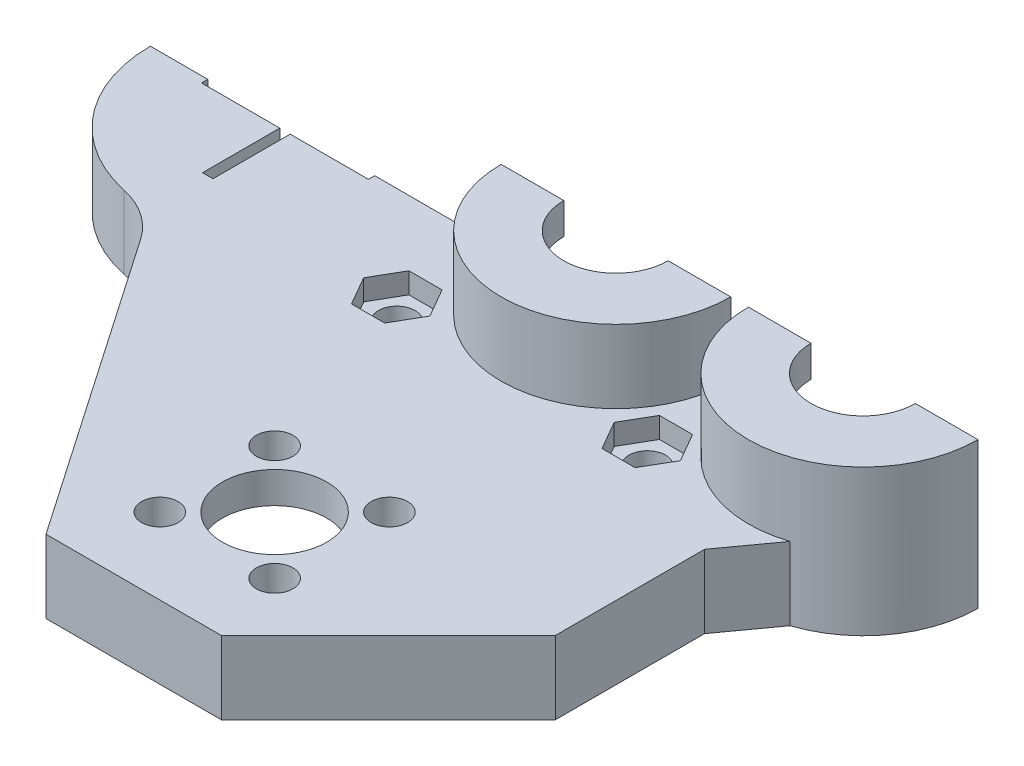
from build123d import *

# Parameters (mm, degrees)
SKETCH3_R               = 8
SKETCH3_R_2             = 5.000000000000001
BOSS_EXTRUDE1_DEPTH     = 7
CUT_EXTRUDE3_DEPTH      = 65.10592616131524
CUT_EXTRUDE3_DEPTH_BACK = 65.10592616131524
SKETCH4_R               = 1.7500000000000004
SKETCH4_R_2             = 1.7500000000000013
SKETCH6_R               = 10.999999999999993
SKETCH6_R_2             = 7.999999999999998
SKETCH6_R_3             = 11
SKETCH6_R_4             = 8
BOSS_EXTRUDE2_DEPTH     = 4
SKETCH7_R               = 10.999999999999993
SKETCH7_R_2             = 5.000000000000001
SKETCH7_R_3             = 11
SKETCH7_R_4             = 5
BOSS_EXTRUDE3_DEPTH     = 3
CHAMFER1_SIZE           = 2.5
CUT_EXTRUDE5_DEPTH      = 66.242392422412
CUT_EXTRUDE5_DEPTH_BACK = 66.242392422412
SKETCH9_R               = 1.7499999999999998
CUT_EXTRUDE6_START      = -2
SKETCH10_R              = 1.7499999999999998
CUT_EXTRUDE6_DEPTH      = 2
CHAMFER3_SIZE2          = 32
CHAMFER3_SIZE           = 22
CHAMFER4_SIZE           = 16
FILLET1_DEPTH           = 7
BOSS_EXTRUDE6_START     = -5
SKETCH15_R              = 10.499999999999996
BOSS_EXTRUDE6_DEPTH     = 5
CUT_EXTRUDE7_DEPTH      = 66.24239242241201
CUT_EXTRUDE7_DEPTH_BACK = 66.24239242241201
SKETCH16_W              = 93.91132691471782
SKETCH16_H              = 20.326896629745406
SKETCH17_R              = 11.5
SKETCH17_R_2            = 5.0000000000000036
CUT_EXTRUDE8_DEPTH      = 4


with BuildPart() as part:
    # Sketch3 → Boss-Extrude1 (new body)
    # profile 1 of 10: a face of its own
    with BuildSketch(Plane(origin=(0, 0, 0), x_dir=(1, 0, 0), z_dir=(0, 1, 0))):
        with BuildLine():
            ThreePointArc((-17.613, 0), (-21.567058453981605, 9.545941546018392), (-31.113, 13.500000000000002))
            Line((-31.113, 13.5), (-31.113, 10.499999999999996))
            ThreePointArc((-31.11300000000032, 10.499999999999996), (-23.688378797541365, 7.424621202458859), (-20.613000000000003, 0))
            ThreePointArc((-20.613000000000003, -2.57e-15), (-23.688378797541368, -7.4246212024588605), (-31.11300000000031, -10.499999999999996))
            Line((-31.112999999999992, -10.499999999999996), (-31.112999999999992, -13.500000000000007))
            ThreePointArc((-31.11299999999999, -13.500000000000002), (-21.567058453981602, -9.545941546018385), (-17.613, -3.31e-15))
        make_face()
    # profile 2 of 10: a face of its own
    with BuildSketch(Plane(origin=(0, 0, 0), x_dir=(1, 0, 0), z_dir=(0, 1, 0))):
        with BuildLine():
            Line((-31.113, 10.499999999999996), (-31.113, 13.5))
            ThreePointArc((-31.113, 13.500000000000002), (-44.613, -4.34e-15), (-31.11299999999999, -13.500000000000002))
            Line((-31.112999999999992, -13.500000000000007), (-31.112999999999992, -10.499999999999996))
            ThreePointArc((-31.11300000000031, -10.499999999999996), (-41.613, -8.04e-15), (-31.11300000000032, 10.499999999999996))
        make_face()
    # profile 3 of 10: a face of its own
    with BuildSketch(Plane(origin=(0, 0, 0), x_dir=(1, 0, 0), z_dir=(0, 1, 0))):
        with BuildLine():
            Line((23.690000000000005, 13.500000000000002), (-31.113, 13.5))
            ThreePointArc((-31.113, 13.500000000000002), (-21.567058453981605, 9.545941546018392), (-17.613, 0))
            ThreePointArc((-17.613, -3.31e-15), (-21.567058453981602, -9.545941546018385), (-31.11299999999999, -13.500000000000002))
            Line((-31.112999999999992, -13.500000000000005), (23.690000000000005, -13.499999999999998))
            Line((23.690000000000005, -13.499999999999998), (23.690000000000005, -10.999999999999991))
            ThreePointArc((23.689999999999998, -10.999999999999993), (12.690000000000008, 1.112e-14), (23.690000000000015, 10.999999999999993))
            Line((23.690000000000005, 10.999999999999993), (23.690000000000005, 13.500000000000002))
        make_face()
        with Locations(Location((0, 0, 0), (0, 0, 270))):
            Circle(SKETCH3_R, mode=Mode.SUBTRACT)
    # profile 4 of 10: a face of its own
    with BuildSketch(Plane(origin=(0, 0, 0), x_dir=(1, 0, 0), z_dir=(0, 1, 0))):
        with BuildLine():
            ThreePointArc((-17.613, 0), (-21.567058453981605, 9.545941546018392), (-31.113, 13.500000000000002))
            Line((-31.113, 13.5), (-31.113, 10.499999999999996))
            ThreePointArc((-31.11300000000032, 10.499999999999996), (-23.688378797541365, 7.424621202458859), (-20.613000000000003, 0))
            ThreePointArc((-20.613000000000003, -2.57e-15), (-23.688378797541368, -7.4246212024588605), (-31.11300000000031, -10.499999999999996))
            Line((-31.112999999999992, -10.499999999999996), (-31.112999999999992, -13.500000000000007))
            ThreePointArc((-31.11299999999999, -13.500000000000002), (-21.567058453981602, -9.545941546018385), (-17.613, -3.31e-15))
        make_face()
    # profile 5 of 10: a face of its own
    with BuildSketch(Plane(origin=(0, 0, 0), x_dir=(1, 0, 0), z_dir=(0, 1, 0))):
        with BuildLine():
            Line((-31.113, 10.499999999999996), (-31.113, 13.5))
            ThreePointArc((-31.113, 13.500000000000002), (-44.613, -4.34e-15), (-31.11299999999999, -13.500000000000002))
            Line((-31.112999999999992, -13.500000000000007), (-31.112999999999992, -10.499999999999996))
            ThreePointArc((-31.11300000000031, -10.499999999999996), (-41.613, -8.04e-15), (-31.11300000000032, 10.499999999999996))
        make_face()
    # profile 6 of 10: a face of its own
    with BuildSketch(Plane(origin=(0, 0, 0), x_dir=(1, 0, 0), z_dir=(0, 1, 0))):
        with BuildLine():
            ThreePointArc((34.69, 0), (31.468174593052026, 7.778174593052012), (23.690000000000015, 10.999999999999993))
            Line((23.690000000000005, 10.999999999999993), (23.690000000000005, 7.999999999999998))
            ThreePointArc((23.689999999999863, 7.999999999999998), (29.34685424949233, 5.6568542494924285), (31.689999999999998, 0))
            ThreePointArc((31.689999999999998, -1.96e-15), (29.34685424949233, -5.65685424949243), (23.68999999999986, -7.999999999999998))
            Line((23.690000000000005, -7.999999999999998), (23.690000000000005, -10.999999999999991))
            ThreePointArc((23.689999999999998, -10.999999999999993), (31.468174593052016, -7.77817459305202), (34.69, -2.69e-15))
        make_face()
    # profile 7 of 10: a face of its own
    with BuildSketch(Plane(origin=(0, 0, 0), x_dir=(1, 0, 0), z_dir=(0, 1, 0))):
        with BuildLine():
            Line((23.690000000000005, 7.999999999999998), (23.690000000000005, 10.999999999999993))
            ThreePointArc((23.690000000000015, 10.999999999999993), (12.690000000000008, 1.112e-14), (23.689999999999998, -10.999999999999993))
            Line((23.690000000000005, -10.999999999999991), (23.690000000000005, -7.999999999999998))
            ThreePointArc((23.68999999999986, -7.999999999999998), (15.690000000000003, 9.8e-16), (23.689999999999863, 7.999999999999998))
        make_face()
    # profile 8 of 10: a face of its own
    with BuildSketch(Plane(origin=(0, 0, 0), x_dir=(1, 0, 0), z_dir=(0, 1, 0))):
        Polygon((-31.112999999999992, -13.500000000000005), (23.690000000000005, -13.499999999999998), (23.690000000000005, -45.5), (-31.11299999999999, -45.5), align=None)
        with Locations(Location((0, -32.70757493091458, 0), (0, 0, 270))):
            Circle(SKETCH3_R_2, mode=Mode.SUBTRACT)
    # profile 9 of 10: a face of its own
    with BuildSketch(Plane(origin=(0, 0, 0), x_dir=(1, 0, 0), z_dir=(0, 1, 0))):
        with BuildLine():
            ThreePointArc((34.69, 0), (31.468174593052026, 7.778174593052012), (23.690000000000015, 10.999999999999993))
            Line((23.690000000000005, 10.999999999999993), (23.690000000000005, 7.999999999999998))
            ThreePointArc((23.689999999999863, 7.999999999999998), (29.34685424949233, 5.6568542494924285), (31.689999999999998, 0))
            ThreePointArc((31.689999999999998, -1.96e-15), (29.34685424949233, -5.65685424949243), (23.68999999999986, -7.999999999999998))
            Line((23.690000000000005, -7.999999999999998), (23.690000000000005, -10.999999999999991))
            ThreePointArc((23.689999999999998, -10.999999999999993), (31.468174593052016, -7.77817459305202), (34.69, -2.69e-15))
        make_face()
    # profile 10 of 10: a face of its own
    with BuildSketch(Plane(origin=(0, 0, 0), x_dir=(1, 0, 0), z_dir=(0, 1, 0))):
        with BuildLine():
            Line((23.690000000000005, 7.999999999999998), (23.690000000000005, 10.999999999999993))
            ThreePointArc((23.690000000000015, 10.999999999999993), (12.690000000000008, 1.112e-14), (23.689999999999998, -10.999999999999993))
            Line((23.690000000000005, -10.999999999999991), (23.690000000000005, -7.999999999999998))
            ThreePointArc((23.68999999999986, -7.999999999999998), (15.690000000000003, 9.8e-16), (23.689999999999863, 7.999999999999998))
        make_face()
    extrude(amount=BOSS_EXTRUDE1_DEPTH)

    # Sketch4 → Cut-Extrude3 (cut, two sides: drawn at the far end of the back side and taken through both)
    with BuildSketch(Plane(origin=(0, 0, 0), x_dir=(1, 0, 0), z_dir=(0, 1, 0)).offset(-CUT_EXTRUDE3_DEPTH_BACK)):
        with Locations(Location((5.5, -27.207574930914586, 0), (0, 0, 270))):
            Circle(SKETCH4_R)
        with Locations(Location((5.5, -38.20757493091458, 0), (0, 0, 270))):
            Circle(SKETCH4_R_2)
        with Locations(Location((-5.5, -38.20757493091458, 0), (0, 0, 270))):
            Circle(SKETCH4_R_2)
        with Locations(Location((-5.5, -27.207574930914586, 0), (0, 0, 270))):
            Circle(SKETCH4_R)
    extrude(amount=CUT_EXTRUDE3_DEPTH + CUT_EXTRUDE3_DEPTH_BACK, mode=Mode.SUBTRACT)

    # Sketch6 → Boss-Extrude2 (add)
    # profile 1 of 2: a face of its own
    with BuildSketch(Plane(origin=(0, 7, 0), x_dir=(1, 0, 0), z_dir=(0, 1, 0))):
        with Locations(Location((23.69, 0, 0), (0, 0, 270))):
            Circle(SKETCH6_R)
        with Locations(Location((23.69, 0, 0), (0, 0, 270))):
            Circle(SKETCH6_R_2, mode=Mode.SUBTRACT)
    # profile 2 of 2: a face of its own
    with BuildSketch(Plane(origin=(0, 7, 0), x_dir=(1, 0, 0), z_dir=(0, 1, 0))):
        with Locations(Location((0, 0, 0), (0, 0, 270))):
            Circle(SKETCH6_R_3)
        with Locations(Location((0, 0, 0), (0, 0, 270))):
            Circle(SKETCH6_R_4, mode=Mode.SUBTRACT)
    extrude(amount=BOSS_EXTRUDE2_DEPTH)

    # Sketch7 → Boss-Extrude3 (add)
    # profile 1 of 2: a face of its own
    with BuildSketch(Plane(origin=(0, 11, 0), x_dir=(1, 0, 0), z_dir=(0, 1, 0))):
        with Locations(Location((23.69, 0, 0), (0, 0, 270))):
            Circle(SKETCH7_R)
        with Locations(Location((23.69, 0, 0), (0, 0, 270))):
            Circle(SKETCH7_R_2, mode=Mode.SUBTRACT)
    # profile 2 of 2: a face of its own
    with BuildSketch(Plane(origin=(0, 11, 0), x_dir=(1, 0, 0), z_dir=(0, 1, 0))):
        with Locations(Location((0, 0, 0), (0, 0, 270))):
            Circle(SKETCH7_R_3)
        with Locations(Location((0, 0, 0), (0, 0, 270))):
            Circle(SKETCH7_R_4, mode=Mode.SUBTRACT)
    extrude(amount=BOSS_EXTRUDE3_DEPTH)

    # Chamfer1
    # the kernel refuses this chamfer: 2.5 mm, written as the material it adds along each edge
    with BuildSketch(Plane(origin=(23.690000000000012, 0, -10.999999999999993), x_dir=(0.9912092295509807, 0, 0.13230367815352426), z_dir=(0, 1, 0))) as chamfer1_piece_1_section:
        with BuildLine():
            Line((2.910680919377515, 1e-17), (-CHAMFER1_SIZE * 0.132303678154, CHAMFER1_SIZE * 0.991209229551))
            Line((-CHAMFER1_SIZE * 0.132303678154, CHAMFER1_SIZE * 0.991209229551), (0, 0))
            ThreePointArc((0, 0), (1.4955265802521478, 0.09662506904492212), (2.910680919377515, 1e-17))
        make_face()
    chamfer1_piece_1 = extrude(amount=7, mode=Mode.PRIVATE)
    chamfer1_piece_1 = split(chamfer1_piece_1, bisect_by=Plane(origin=(23.690000000000012, 0, -13.500000000000002), z_dir=(3e-17, 0, 1)), keep=Keep.TOP, mode=Mode.PRIVATE)
    add(chamfer1_piece_1)

    # Sketch9 → Cut-Extrude5 (cut, two sides: drawn at the far end of the back side and taken through both)
    with BuildSketch(Plane(origin=(0, 0, 0), x_dir=(1, 0, 0), z_dir=(0, 1, 0)).offset(-CUT_EXTRUDE5_DEPTH_BACK)):
        with Locations(Location((12, 9, 0), (0, 0, 90))):
            Circle(SKETCH9_R)
        with Locations(Location((12, -9, 0), (0, 0, 90))):
            Circle(SKETCH9_R)
        with Locations(Location((-12, -9, 0), (0, 0, 90))):
            Circle(SKETCH9_R)
        with Locations(Location((-12, 9, 0), (0, 0, 90))):
            Circle(SKETCH9_R)
    extrude(amount=CUT_EXTRUDE5_DEPTH + CUT_EXTRUDE5_DEPTH_BACK, mode=Mode.SUBTRACT)

    # Sketch10 → Cut-Extrude6 (cut)
    # profile 1 of 4: a face of its own
    with BuildSketch(Plane(origin=(0, 7, 0), x_dir=(1, 0, 0), z_dir=(0, 1, 0)).offset(CUT_EXTRUDE6_START)):
        Polygon((-15.17542648054294, -9.000000000000002), (-13.587713240271471, -11.749999999999998), (-10.412286759728527, -11.749999999999998), (-8.824573519457056, -8.999999999999998), (-10.412286759728529, -6.249999999999998), (-13.58771324027147, -6.249999999999998), align=None)
        with Locations(Location((-12, -9, 0), (0, 0, 90))):
            Circle(SKETCH10_R, mode=Mode.SUBTRACT)
    # profile 2 of 4: a face of its own
    with BuildSketch(Plane(origin=(0, 7, 0), x_dir=(1, 0, 0), z_dir=(0, 1, 0)).offset(CUT_EXTRUDE6_START)):
        Polygon((-15.17542648054294, 8.999999999999998), (-13.587713240271473, 6.249999999999999), (-10.41228675972853, 6.249999999999999), (-8.824573519457058, 9), (-10.412286759728529, 11.75), (-13.587713240271468, 11.75), align=None)
        with Locations(Location((-12, 9, 0), (0, 0, 90))):
            Circle(SKETCH10_R, mode=Mode.SUBTRACT)
    # profile 3 of 4: a face of its own
    with BuildSketch(Plane(origin=(0, 7, 0), x_dir=(1, 0, 0), z_dir=(0, 1, 0)).offset(CUT_EXTRUDE6_START)):
        Polygon((15.175426480542939, 8.999999999999998), (13.587713240271471, 11.749999999999996), (10.412286759728532, 11.749999999999996), (8.82457351945706, 8.999999999999995), (10.412286759728527, 6.249999999999997), (13.58771324027147, 6.249999999999997), align=None)
        with Locations(Location((12, 9, 0), (0, 0, 90))):
            Circle(SKETCH10_R, mode=Mode.SUBTRACT)
    # profile 4 of 4: a face of its own
    with BuildSketch(Plane(origin=(0, 7, 0), x_dir=(1, 0, 0), z_dir=(0, 1, 0)).offset(CUT_EXTRUDE6_START)):
        Polygon((15.17542648054294, -9.000000000000002), (13.58771324027147, -6.249999999999999), (10.41228675972853, -6.249999999999999), (8.824573519457058, -9.000000000000002), (10.41228675972853, -11.75), (13.587713240271471, -11.75), align=None)
        with Locations(Location((12, -9, 0), (0, 0, 90))):
            Circle(SKETCH10_R, mode=Mode.SUBTRACT)
    extrude(amount=CUT_EXTRUDE6_DEPTH, mode=Mode.SUBTRACT)

    # Chamfer2
    # the kernel refuses this chamfer: 5 mm, written as the material it adds along each edge
    with BuildSketch(Plane(origin=(23.69, 0, 10.999999999999993), x_dir=(0.9874000606639179, 0, -0.15824386307497393), z_dir=(0, 1, 0))) as chamfer2_piece_1:
        with BuildLine():
            Line((3.622786343886572, 0.1414213562374673), (-0.8058373565311953, -4.287202344190177))
            Line((-0.8058373565311953, -4.287202344190177), (-0.9045773625975885, -4.27137795788268))
            ThreePointArc((-0.9045773625975885, -4.27137795788268), (-0.4437672242597131, -2.1370546546533555), (-0.0987400060663932, 0.01582438630749762))
            Line((-0.0987400060663932, 0.01582438630749762), (0.01582438630749734, 0.09874000606639144))
            ThreePointArc((0.01582438630749734, 0.09874000606639144), (1.8121079396960726, -0.03836531209673867), (3.6069619575790735, 0.24016136230385873))
            Line((3.6069619575790735, 0.24016136230385873), (3.622786343886572, 0.1414213562374673))
        make_face()
    extrude(amount=7)

    # Chamfer3
    chamfer3_edges = [part.edges().sort_by_distance(p)[0] for p in [
        (-31.11299999999999, 3.5, 45.5),
    ]]
    chamfer3_side = [part.faces().sort_by_distance(p)[0] for p in [
        (-30.672999999999988, 3.5, 45.5),
    ]]
    chamfer(chamfer3_edges, length=CHAMFER3_SIZE - 0.0001, length2=CHAMFER3_SIZE2 - 0.0001, reference=chamfer3_side[0])  # a hair under: the kernel refuses the full size

    # Chamfer4
    chamfer4_edges = [part.edges().sort_by_distance(p)[0] for p in [
        (23.690000000000005, 3.5, 45.5),
    ]]
    chamfer(chamfer4_edges, length=CHAMFER4_SIZE)

    # Fillet1: read off the stored shape, not the designer's step
    # Fillet1 outline → Fillet1 (add)
    with BuildSketch(Plane(origin=(0, 0, 0), x_dir=(1, 0, 0), z_dir=(0, 1, 0))):
        with BuildLine():
            ThreePointArc((-31.113, -13.5), (-32.547033058, -13.423619079), (-33.96483904, -13.19534062))
            ThreePointArc((-33.96483904, -13.19534062), (-31.199410591, -14.370304214), (-29.062482337, -16.482571146))
            Line((-29.062482337, -16.482571146), (-31.113, -13.5))
        make_face()
    extrude(amount=FILLET1_DEPTH)

    # Sketch15 → Boss-Extrude6 (add)
    with BuildSketch(Plane(origin=(0, 7, 0), x_dir=(1, 0, 0), z_dir=(0, 1, 0)).offset(BOSS_EXTRUDE6_START)):
        with Locations(Location((-31.113, 0, 0), (0, 0, 270))):
            Circle(SKETCH15_R)
        Polygon((-31.613000000000003, 0.5999999999999996), (-31.613000000000003, 7.999999999999978), (-30.613, 7.999999999999978), (-30.613, 0.5999999999999996), (-23.112999999999996, 0.5999999999999999), (-23.112999999999996, -0.6000000000000001), (-30.613, -0.6000000000000001), (-30.612999999999996, -8.000000000000021), (-31.613000000000003, -8.000000000000023), (-31.613000000000003, -0.6000000000000005), (-39.11299999999999, -0.6000000000000001), (-39.11299999999999, 0.5999999999999999), align=None, mode=Mode.SUBTRACT)
    extrude(amount=BOSS_EXTRUDE6_DEPTH)

    # Sketch16 → Cut-Extrude7 (cut, two sides: drawn at the far end of the back side and taken through both)
    with BuildSketch(Plane(origin=(0, 0, 0), x_dir=(1, 0, 0), z_dir=(0, 1, 0)).offset(-CUT_EXTRUDE7_DEPTH_BACK)):
        with Locations((-7.1890270506767, 10.163448314872703)):
            Rectangle(SKETCH16_W, SKETCH16_H)
    extrude(amount=CUT_EXTRUDE7_DEPTH + CUT_EXTRUDE7_DEPTH_BACK, mode=Mode.SUBTRACT)

    # Sketch17 → Cut-Extrude8 (cut)
    with BuildSketch(Plane(origin=(0, 0, 0), x_dir=(1, 0, 0), z_dir=(0, 1, 0))):
        with Locations(Location((0, -32.70757493091458, 0), (0, 0, 270))):
            Circle(SKETCH17_R)
        with Locations(Location((0, -32.70757493091458, 0), (0, 0, 270))):
            Circle(SKETCH17_R_2, mode=Mode.SUBTRACT)
    extrude(amount=CUT_EXTRUDE8_DEPTH, mode=Mode.SUBTRACT)


solid = part.part
